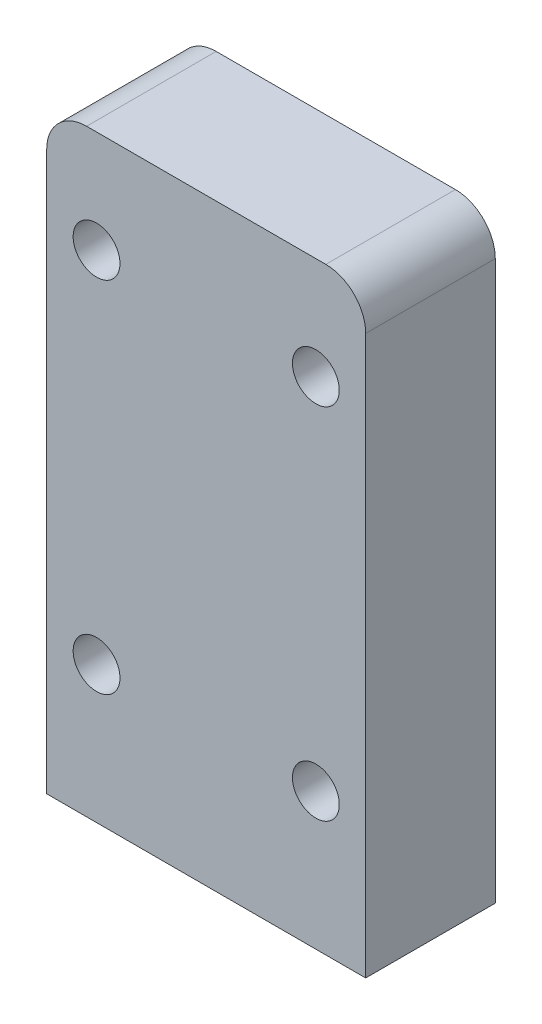
from build123d import *

# Parameters (mm, degrees)
SKETCH1_W           = 16
SKETCH1_H           = 30
BOSS_EXTRUDE1_DEPTH = 6.5
SKETCH3_R           = 1.175
CUT_EXTRUDE1_DEPTH  = 35.615747861
FILLET1_R           = 2
SKETCH4_R           = 1.13
CUT_EXTRUDE2_DEPTH  = 4


with BuildPart() as part:
    # Sketch1 → Boss-Extrude1 (new body)
    with BuildSketch(Plane.XY):
        with Locations((8, 15)):
            Rectangle(SKETCH1_W, SKETCH1_H)
    extrude(amount=BOSS_EXTRUDE1_DEPTH)

    # Sketch3 → Cut-Extrude1 (cut, through all)
    with BuildSketch(Plane(origin=(0, 0, 0), x_dir=(-1, 0, 0), z_dir=(0, 0, -1))):
        with Locations((-13.5, 6.87)):
            Circle(SKETCH3_R)
        with Locations((-2.5, 6.87)):
            Circle(SKETCH3_R)
        with Locations((-2.5, 24.87)):
            Circle(SKETCH3_R)
        with Locations((-13.5, 24.87)):
            Circle(SKETCH3_R)
    extrude(amount=-CUT_EXTRUDE1_DEPTH, mode=Mode.SUBTRACT)

    # Fillet1
    fillet1_edges = [part.edges().sort_by_distance(p)[0] for p in [
        (16, 30, 3.25),
        (0, 30, 3.25),
    ]]
    fillet(fillet1_edges, radius=FILLET1_R)

    # Sketch4 → Cut-Extrude2 (cut)
    with BuildSketch(Plane.XZ):
        with Locations((13.5, 3.25)):
            Circle(SKETCH4_R)
        with Locations((2.5, 3.25)):
            Circle(SKETCH4_R)
    extrude(amount=-CUT_EXTRUDE2_DEPTH, mode=Mode.SUBTRACT)


solid = part.part
